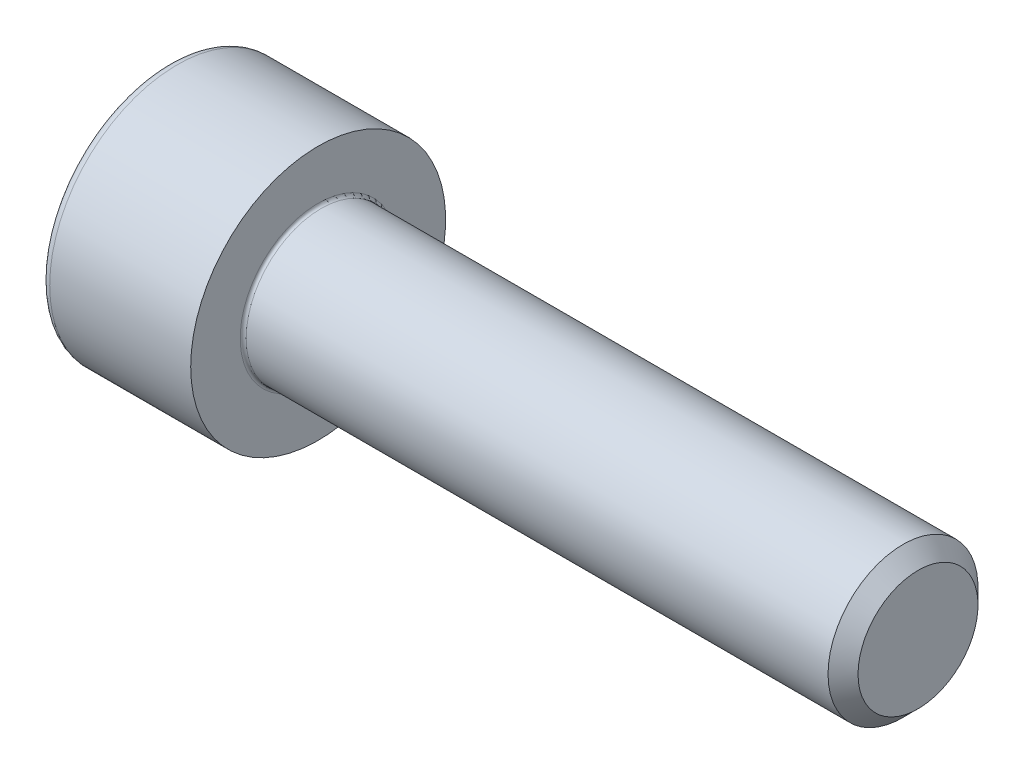
from build123d import *

# Parameters (mm, degrees)
FILLET1_R   = 0.1
FILLET2_R   = 0.3
HEX_2_DEPTH = 1.3


with BuildPart() as part:
    # BodySke → Base-Revolve (revolve)
    with BuildSketch(Plane.XY):
        Polygon((0, 0), (0, 4.25), (5, 4.25), (5, 2.5), (24.5, 2.5), (25, 2), (25, 0), align=None)
    revolve(axis=Axis((-31.75, 0, 0), (1, 0, 0)))

    # Fillet1
    fillet1_edges = [part.edges().sort_by_distance(p)[0] for p in [
        (5, -2.5, 0),
    ]]
    fillet(fillet1_edges, radius=FILLET1_R)

    # Fillet2
    fillet2_edges = [part.edges().sort_by_distance(p)[0] for p in [
        (0, -4.25, 0),
    ]]
    fillet(fillet2_edges, radius=FILLET2_R)

    # Sketch2 → Hex-PreBroach (revolve, cut)
    with BuildSketch(Plane.XY):
        Polygon((0, 2), (1.3, 2), (2.454700538, 0), (0, 0), align=None)
    revolve(axis=Axis((0, 0, 0), (1, 0, 0)), mode=Mode.SUBTRACT)

    # Sketch3 → Hex 2 (cut)
    with BuildSketch(Plane(origin=(0, 0, 0), x_dir=(0, 0.500000000000001, 0.866025403784438), z_dir=(-1, 0, 0))):
        Polygon((1.154700538, 2), (-1.154700538, 2), (-2.309401077, 0), (-1.154700538, -2), (1.154700538, -2), (2.309401077, 0), align=None)
    extrude(amount=-HEX_2_DEPTH, mode=Mode.SUBTRACT)


solid = part.part
